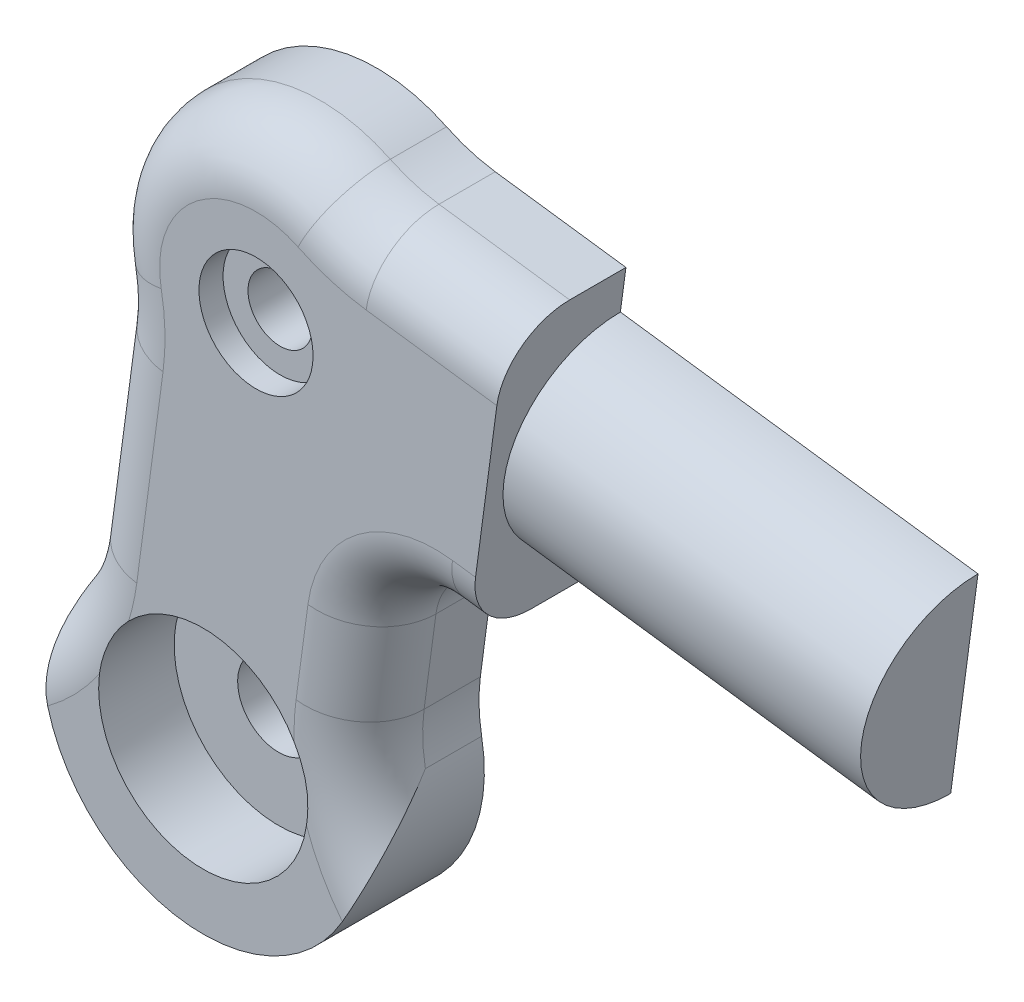
from build123d import *

# Parameters (mm, degrees)
SKETCH_5_R          = 2
SKETCH_5_R_2        = 2.55
EXTRUDE_3_DEPTH     = 15
FILLET_4_R          = 4
SKETCH_6_R          = 6.4
EXTRUDE_4_DEPTH     = 22.45
SKETCH_7_R          = 6.5
CUT_EXTRUDE_1_DEPTH = 4.7
CUT_EXTRUDE_START   = -4.7
SKETCH_8_R          = 6.5
CUT_EXTRUDE_2_DEPTH = 4.7
SKETCH_9_W          = 7.5
SKETCH_9_H          = 50
CUT_EXTRUDE_3_DEPTH = 60.938467095
SKETCH_10_R         = 3.55
CUT_EXTRUDE_4_DEPTH = 1.5


with BuildPart() as part:
    # 草图5 → 凸台-拉伸3 (new body)
    with BuildSketch(Plane.XY):
        with BuildLine():
            Line((15.516814201, 7.002212297), (7.384422843, 8.091371903))
            ThreePointArc((7.384422843, 8.091371903), (5.833974337, 8.425935573), (4.355928265, 9.00143816))
            ThreePointArc((4.355928265, 9.00143816), (-6.069854623, 7.947129347), (-9.830420232, -1.833804259))
            ThreePointArc((-9.830420232, -1.833804259), (-9.664128327, -3.411197812), (-9.749336047, -4.995042206))
            Line((-9.749336047, -4.995042206), (-11.383433357, -17.196301568))
            ThreePointArc((-11.383433357, -17.196301568), (-11.717997026, -18.746750074), (-12.293499614, -20.224796146))
            ThreePointArc((-12.293499614, -20.224796146), (-4.619495141, -34.492228828), (6.538358778, -22.746920152))
            ThreePointArc((6.538358778, -22.746920152), (6.372066873, -21.169526599), (6.457274593, -19.585682205))
            Line((6.457274593, -19.585682205), (7.194690182, -14.07964606))
            ThreePointArc((7.194690182, -14.07964606), (8.731350099, -11.431767797), (11.690265423, -10.646017769))
            Line((11.690265423, -10.646017769), (13.127433564, -10.838495653))
            Line((13.127433564, -10.838495653), (15.516814201, 7.002212297))
        make_face()
        Circle(SKETCH_5_R, mode=Mode.SUBTRACT)
        with Locations((-3.292061454, -24.580724411)):
            Circle(SKETCH_5_R_2, mode=Mode.SUBTRACT)
    extrude(amount=EXTRUDE_3_DEPTH)

    # 圆角4
    # the kernel refuses this fillet: 4 mm, written as the material it takes off along each edge
    with BuildSketch(Plane(origin=(-19.660840464, -3.667608519, 15), x_dir=(0.9830420232040514, 0.18338042593168238, 0), z_dir=(-0.18338042593168238, 0.9830420232040514, 0))) as fillet_4_piece_1:
        with BuildLine():
            CenterArc((10 + FILLET_4_R, FILLET_4_R), FILLET_4_R, 180, 90)
            Line((10 + FILLET_4_R, 0), (10, 0))
            Line((10, 0), (10, FILLET_4_R))
        make_face()
    revolve(axis=Axis((-19.660840464, -3.667608519, 15), (0, 0, -1)), revolution_arc=18.194872339, mode=Mode.SUBTRACT)
    with BuildSketch(Plane(origin=(25.428318618, 5.67477861, 0), x_dir=(0, 0, 1), z_dir=(-0.9911504416884656, 0.132743368726124, 0))) as fillet_4_piece_2:
        with BuildLine():
            CenterArc((FILLET_4_R, -FILLET_4_R), FILLET_4_R, 90, 90)
            Line((0, -FILLET_4_R), (0, 0))
            Line((0, 0), (FILLET_4_R, 0))
        make_face()
    extrude(amount=18.205002002, mode=Mode.SUBTRACT)
    with BuildSketch(Plane(origin=(11.690265423, -10.646017769, 0), x_dir=(0, 0, 1), z_dir=(0.9911504416883519, -0.13274336872697298, 0))) as fillet_4_piece_3:
        with BuildLine():
            CenterArc((FILLET_4_R, -FILLET_4_R), FILLET_4_R, 90, 90)
            Line((0, -FILLET_4_R), (0, 0))
            Line((0, 0), (FILLET_4_R, 0))
        make_face()
    extrude(amount=11.45, mode=Mode.SUBTRACT)
    with BuildSketch(Plane(origin=(11.159291948, -14.610619535, 0), x_dir=(-0.9911504416882816, 0.13274336872749704, 0), z_dir=(-0.13274336872749704, -0.9911504416882816, 0))) as fillet_4_piece_4:
        with BuildLine():
            CenterArc((4 + FILLET_4_R, -FILLET_4_R), FILLET_4_R, 90, 90)
            Line((4 + FILLET_4_R, 0), (4, 0))
            Line((4, 0), (4, -FILLET_4_R))
        make_face()
    revolve(axis=Axis((11.159291948, -14.610619535, 0), (0, 0, -1)), revolution_arc=90, mode=Mode.SUBTRACT)
    with BuildSketch(Plane(origin=(6.457274593, -19.585682205, 0), x_dir=(0, 0, 1), z_dir=(0.13274336872730183, 0.9911504416883078, 0))) as fillet_4_piece_5:
        with BuildLine():
            CenterArc((FILLET_4_R, -FILLET_4_R), FILLET_4_R, 90, 90)
            Line((0, -FILLET_4_R), (0, 0))
            Line((0, 0), (FILLET_4_R, 0))
        make_face()
    extrude(amount=5.555197186, mode=Mode.SUBTRACT)
    with BuildSketch(Plane(origin=(16.368779012, -20.913115892, 0), x_dir=(-0.3768153606688204, -0.9262883913576953, 0), z_dir=(0.9262883913576953, -0.3768153606688204, 0))) as fillet_4_piece_6:
        with BuildLine():
            CenterArc((10.000000001 + FILLET_4_R, -FILLET_4_R), FILLET_4_R, 90, 90)
            Line((10.000000001 + FILLET_4_R, 0), (10.000000001, 0))
            Line((10.000000001, 0), (10.000000001, -FILLET_4_R))
        make_face()
    revolve(axis=Axis((16.368779012, -20.913115892, 0), (0, 0, -1)), revolution_arc=75.491592277, mode=Mode.SUBTRACT)
    with BuildSketch(Plane(origin=(-9.749336047, -4.995042206, 15), x_dir=(0, 0, -1), z_dir=(-0.13274336872713738, -0.9911504416883298, 0))) as fillet_4_piece_7:
        with BuildLine():
            CenterArc((FILLET_4_R, FILLET_4_R), FILLET_4_R, 180, 90)
            Line((0, FILLET_4_R), (0, 0))
            Line((0, 0), (FILLET_4_R, 0))
        make_face()
    extrude(amount=12.310199188, mode=Mode.SUBTRACT)
    with BuildSketch(Plane(origin=(-21.294937774, -15.868867881, 0), x_dir=(0.9911504416879034, -0.132743368730321, 0), z_dir=(0.132743368730321, 0.9911504416879034, 0))) as fillet_4_piece_8:
        with BuildLine():
            CenterArc((10 + FILLET_4_R, -FILLET_4_R), FILLET_4_R, 90, 90)
            Line((10 + FILLET_4_R, 0), (10, 0))
            Line((10, 0), (10, -FILLET_4_R))
        make_face()
    revolve(axis=Axis((-21.294937774, -15.868867881, 0), (0, 0, -1)), revolution_arc=75.491592288, mode=Mode.SUBTRACT)
    with BuildSketch(Plane(origin=(-9.749336047, -4.995042206, 0), x_dir=(0, 0, 1), z_dir=(-0.13274336872713738, -0.9911504416883298, 0))) as fillet_4_piece_9:
        with BuildLine():
            CenterArc((FILLET_4_R, -FILLET_4_R), FILLET_4_R, 90, 90)
            Line((0, -FILLET_4_R), (0, 0))
            Line((0, 0), (FILLET_4_R, 0))
        make_face()
    extrude(amount=12.310199188, mode=Mode.SUBTRACT)
    with BuildSketch(Plane(origin=(-19.660840464, -3.667608519, 0), x_dir=(0.9830420232040514, 0.18338042593168238, 0), z_dir=(-0.18338042593168238, 0.9830420232040514, 0))) as fillet_4_piece_10:
        with BuildLine():
            CenterArc((10 + FILLET_4_R, -FILLET_4_R), FILLET_4_R, 90, 90)
            Line((10 + FILLET_4_R, 0), (10, 0))
            Line((10, 0), (10, -FILLET_4_R))
        make_face()
    revolve(axis=Axis((-19.660840464, -3.667608519, 0), (0, 0, -1)), revolution_arc=18.194872339, mode=Mode.SUBTRACT)
    with BuildSketch(Plane(origin=(0, 0, 0), x_dir=(0.43559282651439474, 0.900143816003421, 0), z_dir=(0.900143816003421, -0.43559282651439474, 0))) as fillet_4_piece_11:
        with BuildLine():
            CenterArc((10 - FILLET_4_R, FILLET_4_R), FILLET_4_R, 270, 90)
            Line((10 - FILLET_4_R, 0), (10, 0))
            Line((10, 0), (10, FILLET_4_R))
        make_face()
    revolve(axis=Axis((0, 0, 0), (0, 0, 1)), revolution_arc=126.389744678, mode=Mode.SUBTRACT)
    with BuildSketch(Plane(origin=(8.71185653, 18.00287632, 0), x_dir=(-0.13274336873032264, -0.9911504416879031, 0), z_dir=(0.9911504416879031, -0.13274336873032264, 0))) as fillet_4_piece_12:
        with BuildLine():
            CenterArc((10 + FILLET_4_R, -FILLET_4_R), FILLET_4_R, 90, 90)
            Line((10 + FILLET_4_R, 0), (10, 0))
            Line((10, 0), (10, -FILLET_4_R))
        make_face()
    revolve(axis=Axis((8.71185653, 18.00287632, 0), (0, 0, -1)), revolution_arc=18.194872339, mode=Mode.SUBTRACT)
    with BuildSketch(Plane(origin=(-21.294937774, -15.868867881, 15), x_dir=(0.9911504416879034, -0.132743368730321, 0), z_dir=(0.132743368730321, 0.9911504416879034, 0))) as fillet_4_piece_13:
        with BuildLine():
            CenterArc((10 + FILLET_4_R, FILLET_4_R), FILLET_4_R, 180, 90)
            Line((10 + FILLET_4_R, 0), (10, 0))
            Line((10, 0), (10, FILLET_4_R))
        make_face()
    revolve(axis=Axis((-21.294937774, -15.868867881, 15), (0, 0, -1)), revolution_arc=75.491592288, mode=Mode.SUBTRACT)
    with BuildSketch(Plane(origin=(16.368779012, -20.913115892, 15), x_dir=(-0.3768153606688204, -0.9262883913576953, 0), z_dir=(0.9262883913576953, -0.3768153606688204, 0))) as fillet_4_piece_14:
        with BuildLine():
            CenterArc((10.000000001 + FILLET_4_R, FILLET_4_R), FILLET_4_R, 180, 90)
            Line((10.000000001 + FILLET_4_R, 0), (10.000000001, 0))
            Line((10.000000001, 0), (10.000000001, FILLET_4_R))
        make_face()
    revolve(axis=Axis((16.368779012, -20.913115892, 15), (0, 0, -1)), revolution_arc=75.491592277, mode=Mode.SUBTRACT)
    with BuildSketch(Plane(origin=(6.457274593, -19.585682205, 15), x_dir=(0, 0, -1), z_dir=(0.13274336872730183, 0.9911504416883078, 0))) as fillet_4_piece_15:
        with BuildLine():
            CenterArc((FILLET_4_R, FILLET_4_R), FILLET_4_R, 180, 90)
            Line((0, FILLET_4_R), (0, 0))
            Line((0, 0), (FILLET_4_R, 0))
        make_face()
    extrude(amount=5.555197186, mode=Mode.SUBTRACT)
    with BuildSketch(Plane(origin=(11.159291948, -14.610619535, 15), x_dir=(-0.9911504416882816, 0.13274336872749704, 0), z_dir=(-0.13274336872749704, -0.9911504416882816, 0))) as fillet_4_piece_16:
        with BuildLine():
            CenterArc((4 + FILLET_4_R, FILLET_4_R), FILLET_4_R, 180, 90)
            Line((4 + FILLET_4_R, 0), (4, 0))
            Line((4, 0), (4, FILLET_4_R))
        make_face()
    revolve(axis=Axis((11.159291948, -14.610619535, 15), (0, 0, -1)), revolution_arc=90, mode=Mode.SUBTRACT)
    with BuildSketch(Plane(origin=(11.690265423, -10.646017769, 15), x_dir=(0, 0, -1), z_dir=(0.9911504416883519, -0.13274336872697298, 0))) as fillet_4_piece_17:
        with BuildLine():
            CenterArc((FILLET_4_R, FILLET_4_R), FILLET_4_R, 180, 90)
            Line((0, FILLET_4_R), (0, 0))
            Line((0, 0), (FILLET_4_R, 0))
        make_face()
    extrude(amount=11.45, mode=Mode.SUBTRACT)
    with BuildSketch(Plane(origin=(25.428318618, 5.67477861, 15), x_dir=(0, 0, -1), z_dir=(-0.9911504416884656, 0.132743368726124, 0))) as fillet_4_piece_18:
        with BuildLine():
            CenterArc((FILLET_4_R, FILLET_4_R), FILLET_4_R, 180, 90)
            Line((0, FILLET_4_R), (0, 0))
            Line((0, 0), (FILLET_4_R, 0))
        make_face()
    extrude(amount=18.205002002, mode=Mode.SUBTRACT)
    with BuildSketch(Plane(origin=(8.71185653, 18.00287632, 15), x_dir=(-0.13274336873032264, -0.9911504416879031, 0), z_dir=(0.9911504416879031, -0.13274336873032264, 0))) as fillet_4_piece_19:
        with BuildLine():
            CenterArc((10 + FILLET_4_R, FILLET_4_R), FILLET_4_R, 180, 90)
            Line((10 + FILLET_4_R, 0), (10, 0))
            Line((10, 0), (10, FILLET_4_R))
        make_face()
    revolve(axis=Axis((8.71185653, 18.00287632, 15), (0, 0, -1)), revolution_arc=18.194872339, mode=Mode.SUBTRACT)
    with BuildSketch(Plane(origin=(0, 0, 15), x_dir=(0.43559282651439474, 0.900143816003421, 0), z_dir=(0.900143816003421, -0.43559282651439474, 0))) as fillet_4_piece_20:
        with BuildLine():
            CenterArc((10 - FILLET_4_R, -FILLET_4_R), FILLET_4_R, 0, 90)
            Line((10 - FILLET_4_R, 0), (10, 0))
            Line((10, 0), (10, -FILLET_4_R))
        make_face()
    revolve(axis=Axis((0, 0, 15), (0, 0, 1)), revolution_arc=126.389744678, mode=Mode.SUBTRACT)

    # 草图6 → 凸台-拉伸4 (add)
    with BuildSketch(Plane(origin=(14.322123882, -1.918141678, 0), x_dir=(0, 0, -1), z_dir=(0.9911504416882867, -0.13274336872745984, 0))):
        with Locations(Location((-7.5, 0, 0), (0, 0, 270))):
            Circle(SKETCH_6_R)
    extrude(amount=EXTRUDE_4_DEPTH)

    # 草图7 → 切除-拉伸1 (cut)
    with BuildSketch(Plane.XY.offset(15)):
        with Locations((-3.292061454, -24.580724411)):
            Circle(SKETCH_7_R)
    extrude(amount=-CUT_EXTRUDE_1_DEPTH, mode=Mode.SUBTRACT)

    # 草图8 → 切除-拉伸2 (cut)
    with BuildSketch(Plane(origin=(0, 0, 0), x_dir=(-1, 0, 0), z_dir=(0, 0, -1)).offset(CUT_EXTRUDE_START)):
        with Locations(Location((3.292061454, -24.580724411, 0), (0, 0, 180))):
            Circle(SKETCH_8_R)
    extrude(amount=CUT_EXTRUDE_2_DEPTH, mode=Mode.SUBTRACT)

    # 草图9 → 切除-拉伸3 (cut, through all)
    with BuildSketch(Plane(origin=(36.573451298, -4.898230306, 0), x_dir=(0, 0, -1), z_dir=(0.9911504416882867, -0.13274336872745987, 0))):
        with Locations((-3.75, -9.800195184)):
            Rectangle(SKETCH_9_W, SKETCH_9_H)
    extrude(amount=-CUT_EXTRUDE_3_DEPTH, mode=Mode.SUBTRACT)

    # 草图10 → 切除-拉伸4 (cut)
    with BuildSketch(Plane.XY.offset(15)):
        Circle(SKETCH_10_R)
    extrude(amount=-CUT_EXTRUDE_4_DEPTH, mode=Mode.SUBTRACT)


solid = part.part
